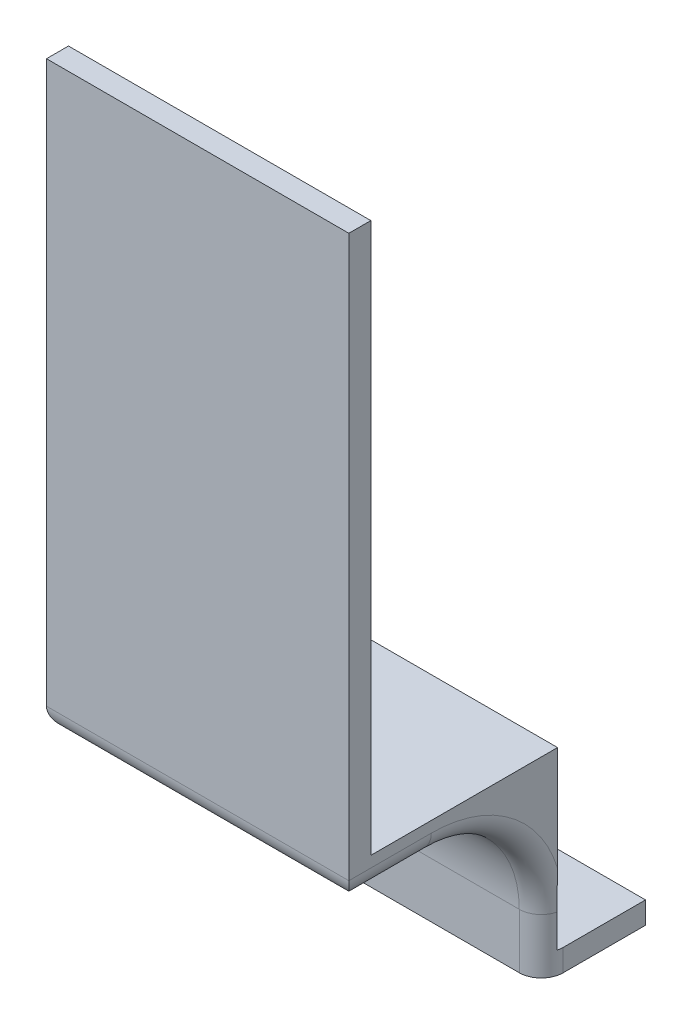
from build123d import *

# Parameters (mm, degrees)
SKETCH_1_W           = 30
SKETCH_1_H           = 11
EXTRUDE_1_DEPTH      = 6
SKETCH_2_W           = 16
SKETCH_2_H           = 2
CUT_EXTRUDE_1_DEPTH  = 144
EXTRUDE_2_DEPTH      = 50
SKETCH_4_R           = 1.75
CUT_EXTRUDE_2_DEPTH  = 144
SKETCH_5_W           = 11
SKETCH_5_H           = 56
CUT_EXTRUDE_3_DEPTH  = 2.5
SKETCH_7_W           = 11
SKETCH_7_H           = 54
CUT_EXTRUDE_5_DEPTH  = 47
EXTRUDE_3_DEPTH      = 16
EXTRUDE_3_DEPTH_BACK = 2
SKETCH_8_W           = 27.5
SKETCH_8_H           = 1.482402205
SKETCH_9_W           = 27.5
SKETCH_9_H           = 3
EXTRUDE_4_DEPTH      = 16
SKETCH_10_W          = 3
SKETCH_10_H          = 18
CUT_EXTRUDE_6_DEPTH  = 47
SKETCH_12_W          = 27.5
SKETCH_12_H          = 3
EXTRUDE_5_DEPTH      = 15.5
SKETCH_13_W          = 27.5
SKETCH_13_H          = 2
EXTRUDE_6_DEPTH      = 53
SKETCH_14_W          = 27.5
SKETCH_14_H          = 18.982402205
EXTRUDE_7_DEPTH      = 3
SKETCH_15_W          = 27.5
SKETCH_15_H          = 2
EXTRUDE_8_DEPTH      = 13
SKETCH_16_W          = 27.5
SKETCH_16_H          = 10
EXTRUDE_9_DEPTH      = 2
CUT_EXTRUDE_START    = -6
SKETCH_17_R          = 1.75
CUT_EXTRUDE_8_DEPTH  = 6
FILLET_1_R           = 10
FILLET_2_R           = 2
CUT_EXTRUDE_9_DEPTH  = 63
SKETCH_19_W          = 18.982402205
SKETCH_19_H          = 16.821441914
CUT_EXTRUDE_10_DEPTH = 63


with BuildPart() as part:
    # 草图1 → 凸台-拉伸1 (new body)
    with BuildSketch(Plane(origin=(0, 0, 0), x_dir=(1, 0, 0), z_dir=(0, 1, 0))):
        Rectangle(SKETCH_1_W, SKETCH_1_H)
    extrude(amount=EXTRUDE_1_DEPTH)

    # 草图2 → 切除-拉伸1 (cut)
    with BuildSketch(Plane.ZY.offset(15)):
        with Locations((-5.5, 3)):
            Rectangle(SKETCH_2_W, SKETCH_2_H)
    extrude(amount=-CUT_EXTRUDE_1_DEPTH, mode=Mode.SUBTRACT)

    # 草图3 → 凸台-拉伸2 (add)
    with BuildSketch(Plane(origin=(0, 6, 0), x_dir=(1, 0, 0), z_dir=(0, 1, 0))):
        Polygon((2, 5.5), (-2, 5.5), (-2, -3.5), (-15, -3.5), (-15, -5.5), (15, -5.5), (15, -3.5), (2, -3.5), align=None)
    extrude(amount=EXTRUDE_2_DEPTH)

    # 草图4 → 切除-拉伸2 (cut)
    with BuildSketch(Plane(origin=(0, 6, 0), x_dir=(1, 0, 0), z_dir=(0, 1, 0))):
        with Locations(Location((-7.5, 2, 0), (0, 0, 270))):
            Circle(SKETCH_4_R)
        with Locations(Location((7.5, 2, 0), (0, 0, 270))):
            Circle(SKETCH_4_R)
    extrude(amount=-CUT_EXTRUDE_2_DEPTH, mode=Mode.SUBTRACT)

    # 草图5 → 切除-拉伸3 (cut)
    with BuildSketch(Plane.ZY.offset(15)):
        with Locations((0, 28)):
            Rectangle(SKETCH_5_W, SKETCH_5_H)
    extrude(amount=-CUT_EXTRUDE_3_DEPTH, mode=Mode.SUBTRACT)

    # 草图7 → 切除-拉伸5 (cut)
    with BuildSketch(Plane.ZY.offset(12.5)):
        with Locations((0, 29)):
            Rectangle(SKETCH_7_W, SKETCH_7_H)
    extrude(amount=-CUT_EXTRUDE_5_DEPTH, mode=Mode.SUBTRACT)

    # 草图8 → 凸台-拉伸3 (add, two sides: drawn at the far end of the back side and taken through both)
    with BuildSketch(Plane(origin=(0, 2, 0), x_dir=(1, 0, 0), z_dir=(0, 1, 0)).offset(-EXTRUDE_3_DEPTH_BACK)):
        with Locations((1.25, -6.241201102)):
            Rectangle(SKETCH_8_W, SKETCH_8_H)
    extrude(amount=EXTRUDE_3_DEPTH + EXTRUDE_3_DEPTH_BACK)

    # 草图9 → 凸台-拉伸4 (add)
    with BuildSketch(Plane(origin=(0, 2, 0), x_dir=(1, 0, 0), z_dir=(0, 1, 0))):
        with Locations((1.25, -4)):
            Rectangle(SKETCH_9_W, SKETCH_9_H)
    extrude(amount=EXTRUDE_4_DEPTH)

    # 草图10 → 切除-拉伸6 (cut)
    with BuildSketch(Plane(origin=(15, 0, 0), x_dir=(0, 0, -1), z_dir=(1, 0, 0))):
        with Locations((-5.482402205, 9)):
            Rectangle(SKETCH_10_W, SKETCH_10_H)
    extrude(amount=-CUT_EXTRUDE_6_DEPTH, mode=Mode.SUBTRACT)

    # 草图12 → 凸台-拉伸5 (add)
    with BuildSketch(Plane.XY.offset(3.982402205)):
        with Locations((1.25, 16.5)):
            Rectangle(SKETCH_12_W, SKETCH_12_H)
    extrude(amount=EXTRUDE_5_DEPTH)

    # 草图13 → 凸台-拉伸6 (add)
    with BuildSketch(Plane(origin=(0, 15, 0), x_dir=(-1, 0, 0), z_dir=(0, -1, 0))):
        with Locations((-1.25, -20.482402205)):
            Rectangle(SKETCH_13_W, SKETCH_13_H)
    extrude(amount=-EXTRUDE_6_DEPTH)

    # 草图14 → 凸台-拉伸7 (add)
    with BuildSketch(Plane(origin=(0, 68, 0), x_dir=(1, 0, 0), z_dir=(0, 1, 0))):
        with Locations((1.25, -11.991201102)):
            Rectangle(SKETCH_14_W, SKETCH_14_H)
    extrude(amount=EXTRUDE_7_DEPTH)

    # 草图15 → 凸台-拉伸8 (add)
    with BuildSketch(Plane(origin=(0, 71, 0), x_dir=(1, 0, 0), z_dir=(0, 1, 0))):
        with Locations((1.25, -3.5)):
            Rectangle(SKETCH_15_W, SKETCH_15_H)
    extrude(amount=EXTRUDE_8_DEPTH)

    # 草图16 → 凸台-拉伸9 (add)
    with BuildSketch(Plane(origin=(0, 84, 0), x_dir=(1, 0, 0), z_dir=(0, 1, 0))):
        with Locations((1.25, 0.5)):
            Rectangle(SKETCH_16_W, SKETCH_16_H)
    extrude(amount=EXTRUDE_9_DEPTH)

    # 草图17 → 切除-拉伸8 (cut)
    with BuildSketch(Plane(origin=(0, 84, 0), x_dir=(-1, 0, 0), z_dir=(0, -1, 0)).offset(CUT_EXTRUDE_START)):
        with Locations(Location((7.5, 2, 0), (0, 0, 270))):
            Circle(SKETCH_17_R)
        with Locations(Location((-7.5, 2, 0), (0, 0, 270))):
            Circle(SKETCH_17_R)
    extrude(amount=CUT_EXTRUDE_8_DEPTH, mode=Mode.SUBTRACT)

    # 圆角1
    fillet_1_edges = [part.edges().sort_by_distance(p)[0] for p in [
        (1.25, 15, 3.982402205),
        (1.25, 71, 4.5),
    ]]
    fillet(fillet_1_edges, radius=FILLET_1_R)

    # 圆角2
    # the kernel refuses this fillet: 2 mm, written as the material it takes off along each edge
    with BuildSketch(Plane(origin=(-12.5, -5, 3.982402205), x_dir=(1, 0, 0), z_dir=(0, 1, 0)), Plane(origin=(-12.5, 81, 4.5), x_dir=(1, 0, 0), z_dir=(0, 1, 0))) as fillet_2_piece_1:
        with BuildLine():
            CenterArc((FILLET_2_R, FILLET_2_R), FILLET_2_R, 180, 90)
            Line((0, FILLET_2_R), (0, 0))
            Line((0, 0), (FILLET_2_R, 0))
        make_face()
    extrude(amount=10, mode=Mode.SUBTRACT)
    with BuildSketch(Plane(origin=(15, 5, 3.982402205), x_dir=(0, 0, -1), z_dir=(0, -1, 0)), Plane(origin=(15, 91, 4.5), x_dir=(0, 0, -1), z_dir=(0, -1, 0))) as fillet_2_piece_2:
        with BuildLine():
            CenterArc((FILLET_2_R, -FILLET_2_R), FILLET_2_R, 90, 90)
            Line((0, -FILLET_2_R), (0, 0))
            Line((0, 0), (FILLET_2_R, 0))
        make_face()
    extrude(amount=10, mode=Mode.SUBTRACT)
    with BuildSketch(Plane(origin=(-12.5, 15, 13.982402205), x_dir=(1, 0, 0), z_dir=(0, 0, 1))) as fillet_2_piece_3:
        with BuildLine():
            CenterArc((FILLET_2_R, FILLET_2_R), FILLET_2_R, 180, 90)
            Line((0, FILLET_2_R), (0, 0))
            Line((0, 0), (FILLET_2_R, 0))
        make_face()
    extrude(amount=12.5, mode=Mode.SUBTRACT)
    with BuildSketch(Plane(origin=(15, 15, 26.482402205), x_dir=(0, 1, 0), z_dir=(0, 0, -1))) as fillet_2_piece_4:
        with BuildLine():
            CenterArc((FILLET_2_R, -FILLET_2_R), FILLET_2_R, 90, 90)
            Line((0, -FILLET_2_R), (0, 0))
            Line((0, 0), (FILLET_2_R, 0))
        make_face()
    extrude(amount=12.5, mode=Mode.SUBTRACT)
    with BuildSketch(Plane(origin=(20, 15, 21.482402205), x_dir=(0, 1, 0), z_dir=(-1, 0, 0))) as fillet_2_piece_5:
        with BuildLine():
            CenterArc((FILLET_2_R, FILLET_2_R), FILLET_2_R, 180, 90)
            Line((0, FILLET_2_R), (0, 0))
            Line((0, 0), (FILLET_2_R, 0))
        make_face()
    extrude(amount=37.5, mode=Mode.SUBTRACT)
    with BuildSketch(Plane(origin=(-17.5, 71, 21.482402205), x_dir=(0, 0, -1), z_dir=(1, 0, 0))) as fillet_2_piece_6:
        with BuildLine():
            CenterArc((FILLET_2_R, -FILLET_2_R), FILLET_2_R, 90, 90)
            Line((0, -FILLET_2_R), (0, 0))
            Line((0, 0), (FILLET_2_R, 0))
        make_face()
    extrude(amount=37.5, mode=Mode.SUBTRACT)
    with BuildSketch(Plane(origin=(15, 71, 26.482402205), x_dir=(0, -1, 0), z_dir=(0, 0, -1))) as fillet_2_piece_7:
        with BuildLine():
            CenterArc((FILLET_2_R, FILLET_2_R), FILLET_2_R, 180, 90)
            Line((0, FILLET_2_R), (0, 0))
            Line((0, 0), (FILLET_2_R, 0))
        make_face()
    extrude(amount=11.982402205, mode=Mode.SUBTRACT)
    with BuildSketch(Plane(origin=(-12.5, 71, 14.5), x_dir=(1, 0, 0), z_dir=(0, 0, 1))) as fillet_2_piece_8:
        with BuildLine():
            CenterArc((FILLET_2_R, -FILLET_2_R), FILLET_2_R, 90, 90)
            Line((0, -FILLET_2_R), (0, 0))
            Line((0, 0), (FILLET_2_R, 0))
        make_face()
    extrude(amount=11.982402205, mode=Mode.SUBTRACT)
    with BuildSketch(Plane(origin=(15, 81, 14.5), x_dir=(0, 0, -1), z_dir=(0, 1, 0))) as fillet_2_piece_9:
        with BuildLine():
            CenterArc((10 + FILLET_2_R, FILLET_2_R), FILLET_2_R, 180, 90)
            Line((10, FILLET_2_R), (10, 0))
            Line((10, 0), (10 + FILLET_2_R, 0))
        make_face()
    revolve(axis=Axis((15, 81, 14.5), (-1, 0, 0)), revolution_arc=90, mode=Mode.SUBTRACT)
    with BuildSketch(Plane(origin=(-12.5, 81, 14.5), x_dir=(0, 0, -1), z_dir=(0, 1, 0))) as fillet_2_piece_10:
        with BuildLine():
            CenterArc((10 + FILLET_2_R, -FILLET_2_R), FILLET_2_R, 90, 90)
            Line((10 + FILLET_2_R, 0), (10, 0))
            Line((10, 0), (10, -FILLET_2_R))
        make_face()
    revolve(axis=Axis((-12.5, 81, 14.5), (-1, 0, 0)), revolution_arc=90, mode=Mode.SUBTRACT)
    with BuildSketch(Plane(origin=(15, 5, 13.982402205), x_dir=(0, 0, -1), z_dir=(0, -1, 0))) as fillet_2_piece_11:
        with BuildLine():
            CenterArc((10 + FILLET_2_R, -FILLET_2_R), FILLET_2_R, 90, 90)
            Line((10, -FILLET_2_R), (10, 0))
            Line((10, 0), (10 + FILLET_2_R, 0))
        make_face()
    revolve(axis=Axis((15, 5, 13.982402205), (1, 0, 0)), revolution_arc=90, mode=Mode.SUBTRACT)
    with BuildSketch(Plane(origin=(-12.5, 5, 13.982402205), x_dir=(0, 0, -1), z_dir=(0, -1, 0))) as fillet_2_piece_12:
        with BuildLine():
            CenterArc((10 + FILLET_2_R, FILLET_2_R), FILLET_2_R, 180, 90)
            Line((10 + FILLET_2_R, 0), (10, 0))
            Line((10, 0), (10, FILLET_2_R))
        make_face()
    revolve(axis=Axis((-12.5, 5, 13.982402205), (1, 0, 0)), revolution_arc=90, mode=Mode.SUBTRACT)

    # 草图18 → 切除-拉伸9 (cut)
    with BuildSketch(Plane(origin=(15, 0, 0), x_dir=(0, 0, -1), z_dir=(1, 0, 0))):
        with BuildLine():
            Line((-2.5, 81), (-2.5, 68))
            Line((-2.5, 68), (12.398606428, 68))
            Line((12.398606428, 68), (12.398606428, 90.674751071))
            Line((12.398606428, 90.674751071), (-21.482402205, 90.674751071))
            Line((-21.482402205, 90.674751071), (-21.482402205, 69))
            Line((-21.482402205, 69), (-14.5, 69))
            ThreePointArc((-14.5, 69), (-6.014718626, 72.514718626), (-2.5, 81))
        make_face()
    extrude(amount=-CUT_EXTRUDE_9_DEPTH, mode=Mode.SUBTRACT)

    # 草图19 → 切除-拉伸10 (cut)
    with BuildSketch(Plane(origin=(15, 0, 0), x_dir=(0, 0, -1), z_dir=(1, 0, 0))):
        with Locations((-11.991201102, 76.410720957)):
            Rectangle(SKETCH_19_W, SKETCH_19_H)
    extrude(amount=-CUT_EXTRUDE_10_DEPTH, mode=Mode.SUBTRACT)


solid = part.part
